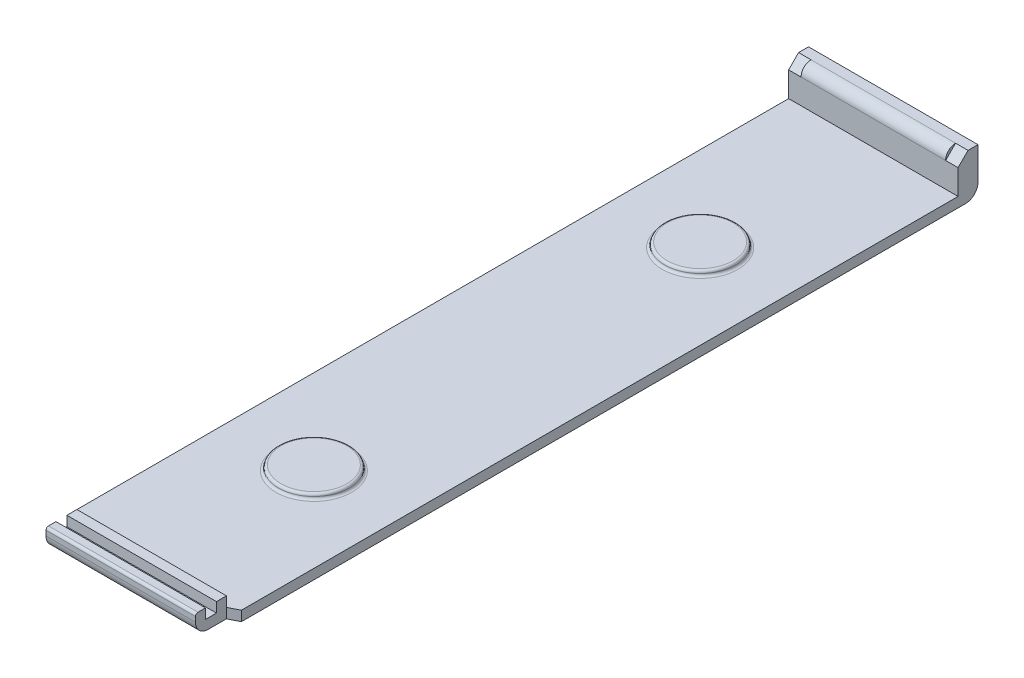
from build123d import *

# Parameters (mm, degrees)
SKETCH1_W                       = 39
SKETCH1_H                       = 155
BOSS_EXTRUDE1_DEPTH             = 2
BOSS_EXTRUDE2_DEPTH             = 38
SKETCH3_W                       = 2
SKETCH3_H                       = 2
BOSS_EXTRUDE3_DEPTH             = 38
SKETCH4_W                       = 2
SKETCH4_H                       = 2
BOSS_EXTRUDE4_DEPTH             = 151
SKETCH6_W                       = 35
SKETCH6_H                       = 2.2
CUT_EXTRUDE1_DEPTH              = 160.340045186
SKETCH7_W                       = 35
SKETCH7_H                       = 2.2
CUT_EXTRUDE2_DEPTH              = 89.490112442
SKETCH5_W                       = 31
SKETCH5_H                       = 2
BOSS_EXTRUDE5_DEPTH             = 2
BOSS_EXTRUDE6_REACH             = 91.367
SKETCH8_W                       = 2
SKETCH8_H                       = 2
BOSS_EXTRUDE6_DIRECTION_2_REACH = 91.367
SKETCH10_W                      = 2
SKETCH10_H                      = 2.2
SKETCH10_W_2                    = 2.2
SKETCH10_H_2                    = 2
BOSS_EXTRUDE8_DEPTH             = 2
SKETCH11_W                      = 2
SKETCH11_H                      = 2.2
SKETCH11_W_2                    = 2.2
SKETCH11_H_2                    = 2
BOSS_EXTRUDE9_DEPTH             = 2
FILLET2_R                       = 2.5
SKETCH14_W                      = 36.5
SKETCH14_H                      = 7.75
BOSS_EXTRUDE10_DEPTH            = 2
SKETCH13_W                      = 31
SKETCH13_H                      = 3
CUT_EXTRUDE4_DEPTH              = 2
FILLET3_R                       = 2
FILLET4_R                       = 0.5
SKETCH15_R                      = 5.1
CUT_EXTRUDE5_DEPTH              = 90.367219941
SKETCH16_R                      = 7.1
BOSS_EXTRUDE11_DEPTH            = 1
FILLET5_R                       = 0.5
CUT_EXTRUDE3_DEPTH              = 160.340045186
FILLET6_R                       = 0.4
FILLET7_R                       = 0.5
CUT_EXTRUDE8_DEPTH              = 90.367220028
CUT_EXTRUDE8_DEPTH_BACK         = 90.367220028
CUT_EXTRUDE11_DEPTH             = 81.420768473
CUT_EXTRUDE12_DEPTH             = 80.851424566
CUT_EXTRUDE13_DEPTH             = 2.5


with BuildPart() as part:
    # Sketch1 → Boss-Extrude1 (new body)
    with BuildSketch(Plane(origin=(0, 0, 0), x_dir=(1, 0, 0), z_dir=(0, 1, 0))):
        Rectangle(SKETCH1_W, SKETCH1_H)
    extrude(amount=BOSS_EXTRUDE1_DEPTH)

    # Sketch2 → Boss-Extrude2 (add)
    with BuildSketch(Plane(origin=(0, 2, 0), x_dir=(1, 0, 0), z_dir=(0, 1, 0))):
        Polygon((-17.5, -77.5), (-17.5, -75.5), (-17.5, 75.5), (17.5, 75.5), (17.5, -75.5), (17.5, -77.5), (19.5, -77.5), (19.5, 77.5), (-19.5, 77.5), (-19.5, -77.5), align=None)
    extrude(amount=BOSS_EXTRUDE2_DEPTH)

    # Sketch3 → Boss-Extrude3 (add)
    with BuildSketch(Plane(origin=(0, 2, 0), x_dir=(1, 0, 0), z_dir=(0, 1, 0))):
        with Locations((-16.5, -76.5)):
            Rectangle(SKETCH3_W, SKETCH3_H)
        with Locations((-16.5, -72.3)):
            Rectangle(SKETCH3_W, SKETCH3_H)
        with Locations((16.5, -76.5)):
            Rectangle(SKETCH3_W, SKETCH3_H)
        with Locations((16.5, -72.3)):
            Rectangle(SKETCH3_W, SKETCH3_H)
    extrude(amount=BOSS_EXTRUDE3_DEPTH)

    # Sketch4 → Boss-Extrude4 (add)
    with BuildSketch(Plane.XY.offset(-75.5)):
        with Locations((-16.5, 39)):
            Rectangle(SKETCH4_W, SKETCH4_H)
        Polygon((-15.5, 33.8), (-17.5, 31.8), (-17.5, 35.8), (-15.5, 35.8), align=None)
        Polygon((15.5, 35.8), (17.5, 35.8), (17.5, 31.8), (15.5, 33.8), align=None)
        with Locations((16.5, 39)):
            Rectangle(SKETCH4_W, SKETCH4_H)
    extrude(amount=BOSS_EXTRUDE4_DEPTH)

    # Sketch6 → Cut-Extrude1 (cut, through all)
    with BuildSketch(Plane.XY.offset(-75.5)):
        with Locations((0, 36.9)):
            Rectangle(SKETCH6_W, SKETCH6_H)
    extrude(amount=CUT_EXTRUDE1_DEPTH, mode=Mode.SUBTRACT)

    # Sketch7 → Cut-Extrude2 (cut, through all)
    with BuildSketch(Plane(origin=(0, 2, 0), x_dir=(1, 0, 0), z_dir=(0, 1, 0))):
        with Locations((0, -74.4)):
            Rectangle(SKETCH7_W, SKETCH7_H)
    extrude(amount=CUT_EXTRUDE2_DEPTH, mode=Mode.SUBTRACT)

    # Sketch5 → Boss-Extrude5 (add)
    with BuildSketch(Plane(origin=(0, 2, 0), x_dir=(1, 0, 0), z_dir=(0, 1, 0))):
        with Locations((0, -76.5)):
            Rectangle(SKETCH5_W, SKETCH5_H)
        with Locations((0, -72.3)):
            Rectangle(SKETCH5_W, SKETCH5_H)
    extrude(amount=BOSS_EXTRUDE5_DEPTH)

    # Boss-Extrude6: up to this face of the body (flat: up to its plane)
    boss_extrude6_end = Plane(part.part.faces().sort_by_distance((17.5, 16.9, -2.1))[0])
    # Sketch8 → Boss-Extrude6 (add, up to the picked face)
    with BuildSketch(Plane(origin=(0, 0, 0), x_dir=(0, 0, -1), z_dir=(1, 0, 0)), mode=Mode.PRIVATE) as boss_extrude6_sk1:
        with Locations((74.5, 39)):
            Rectangle(SKETCH8_W, SKETCH8_H)
    boss_extrude6_tool1 = split(extrude(boss_extrude6_sk1.sketch, amount=BOSS_EXTRUDE6_REACH, mode=Mode.PRIVATE), bisect_by=boss_extrude6_end, keep=Keep.BOTH, mode=Mode.PRIVATE)
    # Sketch8 → Boss-Extrude6 (add, up to the picked face)
    with BuildSketch(Plane(origin=(0, 0, 0), x_dir=(0, 0, -1), z_dir=(1, 0, 0)), mode=Mode.PRIVATE) as boss_extrude6_sk2:
        Polygon((75.5, 35.8), (73.5, 35.8), (73.5, 33.8), (75.5, 31.8), align=None)
    boss_extrude6_tool2 = split(extrude(boss_extrude6_sk2.sketch, amount=BOSS_EXTRUDE6_REACH, mode=Mode.PRIVATE), bisect_by=boss_extrude6_end, keep=Keep.BOTH, mode=Mode.PRIVATE)
    add(boss_extrude6_tool1.solids().sort_by(Axis((0, 39, -74.5), (1, 0, 0)))[0])
    add(boss_extrude6_tool2.solids().sort_by(Axis((0, 34.244444, -74.611111), (1, 0, 0)))[0])

    # Boss-Extrude6 direction 2: up to this face of the body (flat: up to its plane)
    boss_extrude6_direction_2_end = Plane(part.part.faces().sort_by_distance((-17.5, 16.9, -2.1))[0])
    # Sketch8 → Boss-Extrude6 direction 2 (add, up to the picked face)
    with BuildSketch(Plane(origin=(0, 0, 0), x_dir=(0, 0, -1), z_dir=(1, 0, 0)), mode=Mode.PRIVATE) as boss_extrude6_direction_2_sk1:
        with Locations((74.5, 39)):
            Rectangle(SKETCH8_W, SKETCH8_H)
    boss_extrude6_direction_2_tool1 = split(extrude(boss_extrude6_direction_2_sk1.sketch, amount=-BOSS_EXTRUDE6_DIRECTION_2_REACH, mode=Mode.PRIVATE), bisect_by=boss_extrude6_direction_2_end, keep=Keep.BOTH, mode=Mode.PRIVATE)
    # Sketch8 → Boss-Extrude6 direction 2 (add, up to the picked face)
    with BuildSketch(Plane(origin=(0, 0, 0), x_dir=(0, 0, -1), z_dir=(1, 0, 0)), mode=Mode.PRIVATE) as boss_extrude6_direction_2_sk2:
        Polygon((75.5, 35.8), (73.5, 35.8), (73.5, 33.8), (75.5, 31.8), align=None)
    boss_extrude6_direction_2_tool2 = split(extrude(boss_extrude6_direction_2_sk2.sketch, amount=-BOSS_EXTRUDE6_DIRECTION_2_REACH, mode=Mode.PRIVATE), bisect_by=boss_extrude6_direction_2_end, keep=Keep.BOTH, mode=Mode.PRIVATE)
    add(boss_extrude6_direction_2_tool1.solids().sort_by(Axis((0, 39, -74.5), (-1, 0, 0)))[0])
    add(boss_extrude6_direction_2_tool2.solids().sort_by(Axis((0, 34.244444, -74.611111), (-1, 0, 0)))[0])

    # Sketch10 → Boss-Extrude8 (add)
    with BuildSketch(Plane(origin=(-17.5, 0, 0), x_dir=(0, 0, -1), z_dir=(1, 0, 0))):
        with Locations((-76.5, 36.9)):
            Rectangle(SKETCH10_W, SKETCH10_H)
        with Locations((-74.4, 39)):
            Rectangle(SKETCH10_W_2, SKETCH10_H_2)
    extrude(amount=BOSS_EXTRUDE8_DEPTH)

    # Sketch11 → Boss-Extrude9 (add)
    with BuildSketch(Plane.ZY.offset(-17.5)):
        with Locations((76.5, 36.9)):
            Rectangle(SKETCH11_W, SKETCH11_H)
        with Locations((74.4, 39)):
            Rectangle(SKETCH11_W_2, SKETCH11_H_2)
    extrude(amount=BOSS_EXTRUDE9_DEPTH)

    # Fillet2
    fillet2_edges = [part.edges().sort_by_distance(p)[0] for p in [
        (-17.5, 16.9, 71.3),
        (17.5, 16.9, 71.3),
        (19.5, 20, 77.5),
        (-19.5, 20, 77.5),
        (-19.5, 20, -77.5),
        (-17.5, 16.9, -75.5),
        (17.5, 16.9, -75.5),
        (19.5, 20, -77.5),
        (19.5, 40, 0),
        (-19.5, 40, 0),
        (19.5, 0, 0),
        (-19.5, 0, 0),
        (0, 40, -77.5),
        (0, 0, 77.5),
        (0, 0, -77.5),
        (-17.5, 40, 77.5),
        (17.5, 40, 77.5),
    ]]
    fillet(fillet2_edges, radius=FILLET2_R)

    # Sketch14 → Boss-Extrude10 (add)
    with BuildSketch(Plane.XY.offset(-75.5)):
        with Locations((0, 5.125)):
            Rectangle(SKETCH14_W, SKETCH14_H)
    extrude(amount=BOSS_EXTRUDE10_DEPTH)

    # Sketch13 → Cut-Extrude4 (cut)
    with BuildSketch(Plane(origin=(0, 0, -77.5), x_dir=(-1, 0, 0), z_dir=(0, 0, -1))):
        with Locations((0, 5.5)):
            Rectangle(SKETCH13_W, SKETCH13_H)
    extrude(amount=-CUT_EXTRUDE4_DEPTH, mode=Mode.SUBTRACT)

    # Fillet3
    fillet3_edges = [part.edges().sort_by_distance(p)[0] for p in [
        (0, 9, -73.5),
    ]]
    fillet(fillet3_edges, radius=FILLET3_R - 0.0001)  # a hair under: the kernel refuses the full size

    # Fillet4
    fillet4_edges = [part.edges().sort_by_distance(p)[0] for p in [
        (15.5, 5.5, -75.5),
        (15.5, 4, -76.5),
        (0, 7, -75.5),
        (15.5, 7, -76.5),
        (-15.5, 5.5, -75.5),
        (-15.5, 7, -76.5),
        (0, 4, -75.5),
        (-15.5, 4, -76.5),
        (15.5, 5.5, -77.5),
        (0, 4, -77.5),
        (-15.5, 5.5, -77.5),
        (0, 7, -77.5),
    ]]
    fillet(fillet4_edges, radius=FILLET4_R)

    # Sketch15 → Cut-Extrude5 (cut, through all)
    with BuildSketch(Plane.XZ):
        with Locations(Location((0, 38.75, 0), (0, 0, 270))):
            Circle(SKETCH15_R)
        with Locations(Location((0, -38.75, 0), (0, 0, 270))):
            Circle(SKETCH15_R)
    extrude(amount=-CUT_EXTRUDE5_DEPTH, mode=Mode.SUBTRACT)

    # Sketch16 → Boss-Extrude11 (add)
    with BuildSketch(Plane(origin=(0, 2, 0), x_dir=(1, 0, 0), z_dir=(0, 1, 0))):
        with Locations(Location((0, 38.75, 0), (0, 0, 270))):
            Circle(SKETCH16_R)
        with Locations(Location((0, -38.75, 0), (0, 0, 270))):
            Circle(SKETCH16_R)
    extrude(amount=BOSS_EXTRUDE11_DEPTH)

    # Fillet5
    fillet5_edges = [part.edges().sort_by_distance(p)[0] for p in [
        (0, 2, -45.85),
        (0, 3, -45.85),
        (0, 2, 31.65),
        (0, 3, 31.65),
    ]]
    fillet(fillet5_edges, radius=FILLET5_R - 0.0001)  # a hair under: the kernel refuses the full size

    # Sketch12 → Cut-Extrude3 (cut, through all)
    with BuildSketch(Plane.XY.offset(-75.5)):
        with BuildLine():
            Line((1.668907005, 12.688040659), (2.22520934, 10.250720878))
            ThreePointArc((2.22520934, 10.250720878), (4.338837391, 10.990311321), (6.234898019, 12.181685175))
            Line((6.234898019, 12.181685175), (4.676173514, 14.136263881))
            ThreePointArc((4.676173514, 14.136263881), (3.254128043, 13.242733491), (1.668907005, 12.688040659))
        make_face()
        with BuildLine():
            ThreePointArc((-6.234898019, 12.181685175), (-4.338837391, 10.990311321), (-2.22520934, 10.250720878))
            Line((-2.22520934, 10.250720878), (-1.668907005, 12.688040659))
            ThreePointArc((-1.668907005, 12.688040659), (-3.254128043, 13.242733491), (-4.676173514, 14.136263881))
            Line((-4.676173514, 14.136263881), (-6.234898019, 12.181685175))
        make_face()
        with BuildLine():
            ThreePointArc((-10, 20), (-9.749279122, 17.77479066), (-9.009688679, 15.661162609))
            Line((-9.009688679, 15.661162609), (-6.757266509, 16.745871957))
            ThreePointArc((-6.757266509, 16.745871957), (-7.311959341, 18.331092995), (-7.5, 20))
            Line((-7.5, 20), (-10, 20))
        make_face()
        with BuildLine():
            ThreePointArc((-6.234898019, 27.818314825), (-7.818314825, 26.234898019), (-9.009688679, 24.338837391))
            Line((-9.009688679, 24.338837391), (-6.757266509, 23.254128043))
            ThreePointArc((-6.757266509, 23.254128043), (-5.863736119, 24.676173514), (-4.676173514, 25.863736119))
            Line((-4.676173514, 25.863736119), (-6.234898019, 27.818314825))
        make_face()
        with BuildLine():
            ThreePointArc((-1.668907005, 27.311959341), (-0.839733571, 27.452841574), (0, 27.5))
            Line((0, 27.5), (0, 30))
            ThreePointArc((0, 30), (-1.119644761, 29.937122099), (-2.22520934, 29.749279122))
            Line((-2.22520934, 29.749279122), (-1.668907005, 27.311959341))
        make_face()
        with BuildLine():
            Line((0, 30), (0, 27.5))
            ThreePointArc((0, 27.5), (0.839733571, 27.452841574), (1.668907005, 27.311959341))
            Line((1.668907005, 27.311959341), (2.22520934, 29.749279122))
            ThreePointArc((2.22520934, 29.749279122), (1.119644761, 29.937122099), (0, 30))
        make_face()
        with BuildLine():
            Line((6.757266509, 23.254128043), (9.009688679, 24.338837391))
            ThreePointArc((9.009688679, 24.338837391), (7.818314825, 26.234898019), (6.234898019, 27.818314825))
            Line((6.234898019, 27.818314825), (4.676173514, 25.863736119))
            ThreePointArc((4.676173514, 25.863736119), (5.863736119, 24.676173514), (6.757266509, 23.254128043))
        make_face()
        with BuildLine():
            Line((6.757266509, 16.745871957), (9.009688679, 15.661162609))
            ThreePointArc((9.009688679, 15.661162609), (9.749279122, 17.77479066), (10, 20))
            Line((10, 20), (7.5, 20))
            ThreePointArc((7.5, 20), (7.311959341, 18.331092995), (6.757266509, 16.745871957))
        make_face()
        with BuildLine():
            ThreePointArc((2.5, 20), (2.43731978, 19.443697665), (2.25242217, 18.915290652))
            Line((2.25242217, 18.915290652), (4.50484434, 17.830581304))
            ThreePointArc((4.50484434, 17.830581304), (4.874639561, 18.88739533), (5, 20))
            Line((5, 20), (2.5, 20))
        make_face()
        with BuildLine():
            ThreePointArc((1.558724505, 21.954578706), (1.954578706, 21.558724505), (2.25242217, 21.084709348))
            Line((2.25242217, 21.084709348), (4.50484434, 22.169418696))
            ThreePointArc((4.50484434, 22.169418696), (3.909157412, 23.117449009), (3.117449009, 23.909157412))
            Line((3.117449009, 23.909157412), (1.558724505, 21.954578706))
        make_face()
        with BuildLine():
            Line((0, 25), (0, 22.5))
            ThreePointArc((0, 22.5), (0.27991119, 22.484280525), (0.556302335, 22.43731978))
            Line((0.556302335, 22.43731978), (1.11260467, 24.874639561))
            ThreePointArc((1.11260467, 24.874639561), (0.559822381, 24.968561049), (0, 25))
        make_face()
        with BuildLine():
            ThreePointArc((-0.556302335, 22.43731978), (-0.27991119, 22.484280525), (0, 22.5))
            Line((0, 22.5), (0, 25))
            ThreePointArc((0, 25), (-0.559822381, 24.968561049), (-1.11260467, 24.874639561))
            Line((-1.11260467, 24.874639561), (-0.556302335, 22.43731978))
        make_face()
        with BuildLine():
            ThreePointArc((-2.25242217, 21.084709348), (-1.954578706, 21.558724505), (-1.558724505, 21.954578706))
            Line((-1.558724505, 21.954578706), (-3.117449009, 23.909157412))
            ThreePointArc((-3.117449009, 23.909157412), (-3.909157412, 23.117449009), (-4.50484434, 22.169418696))
            Line((-4.50484434, 22.169418696), (-2.25242217, 21.084709348))
        make_face()
        with BuildLine():
            ThreePointArc((-2.25242217, 18.915290652), (-2.43731978, 19.443697665), (-2.5, 20))
            Line((-2.5, 20), (-5, 20))
            ThreePointArc((-5, 20), (-4.874639561, 18.88739533), (-4.50484434, 17.830581304))
            Line((-4.50484434, 17.830581304), (-2.25242217, 18.915290652))
        make_face()
        with BuildLine():
            ThreePointArc((-3.117449009, 16.090842588), (-2.169418696, 15.49515566), (-1.11260467, 15.125360439))
            Line((-1.11260467, 15.125360439), (-0.556302335, 17.56268022))
            ThreePointArc((-0.556302335, 17.56268022), (-1.084709348, 17.74757783), (-1.558724505, 18.045421294))
            Line((-1.558724505, 18.045421294), (-3.117449009, 16.090842588))
        make_face()
        with BuildLine():
            Line((0.556302335, 17.56268022), (1.11260467, 15.125360439))
            ThreePointArc((1.11260467, 15.125360439), (2.169418696, 15.49515566), (3.117449009, 16.090842588))
            Line((3.117449009, 16.090842588), (1.558724505, 18.045421294))
            ThreePointArc((1.558724505, 18.045421294), (1.084709348, 17.74757783), (0.556302335, 17.56268022))
        make_face()
    extrude(amount=-CUT_EXTRUDE3_DEPTH, mode=Mode.SUBTRACT)

    # Fillet6
    fillet6_edges = [part.edges().sort_by_distance(p)[0] for p in [
        (5.863736119, 24.676173514, -75.5),
        (5.455535766, 26.841025472, -75.5),
        (7.818314825, 26.234898019, -77.5),
        (7.883477594, 23.796482717, -77.5),
        (5.863736119, 24.676173514, -77.5),
        (5.455535766, 26.841025472, -77.5),
        (7.883477594, 23.796482717, -75.5),
        (7.818314825, 26.234898019, -75.5),
        (7.311959341, 18.331092995, -75.5),
        (8.75, 20, -75.5),
        (9.749279122, 17.77479066, -77.5),
        (7.883477594, 16.203517283, -77.5),
        (7.311959341, 18.331092995, -77.5),
        (8.75, 20, -77.5),
        (7.883477594, 16.203517283, -75.5),
        (9.749279122, 17.77479066, -75.5),
        (2.43731978, 19.443697665, -75.5),
        (3.75, 20, -75.5),
        (4.874639561, 18.88739533, -77.5),
        (3.378633255, 18.372935978, -77.5),
        (2.43731978, 19.443697665, -77.5),
        (3.75, 20, -77.5),
        (3.378633255, 18.372935978, -75.5),
        (4.874639561, 18.88739533, -75.5),
        (1.954578706, 21.558724505, -75.5),
        (2.338086757, 22.931868059, -75.5),
        (3.909157412, 23.117449009, -77.5),
        (3.378633255, 21.627064022, -77.5),
        (1.954578706, 21.558724505, -77.5),
        (2.338086757, 22.931868059, -77.5),
        (3.378633255, 21.627064022, -75.5),
        (3.909157412, 23.117449009, -75.5),
        (0, 27.5, -75.5),
        (-1.947058172, 28.530619232, -75.5),
        (0, 30, -77.5),
        (1.947058172, 28.530619232, -77.5),
        (0, 27.5, -77.5),
        (-1.947058172, 28.530619232, -77.5),
        (1.947058172, 28.530619232, -75.5),
        (0, 30, -75.5),
        (-5.863736119, 24.676173514, -75.5),
        (-7.883477594, 23.796482717, -75.5),
        (-7.818314825, 26.234898019, -77.5),
        (-5.455535766, 26.841025472, -77.5),
        (-5.863736119, 24.676173514, -77.5),
        (-7.883477594, 23.796482717, -77.5),
        (-5.455535766, 26.841025472, -75.5),
        (-7.818314825, 26.234898019, -75.5),
        (-7.311959341, 18.331092995, -75.5),
        (-7.883477594, 16.203517283, -75.5),
        (-9.749279122, 17.77479066, -77.5),
        (-8.75, 20, -77.5),
        (-7.311959341, 18.331092995, -77.5),
        (-7.883477594, 16.203517283, -77.5),
        (-8.75, 20, -75.5),
        (-9.749279122, 17.77479066, -75.5),
        (-3.254128043, 13.242733491, -75.5),
        (-1.947058172, 11.469380768, -75.5),
        (-4.338837391, 10.990311321, -77.5),
        (-5.455535766, 13.158974528, -77.5),
        (-3.254128043, 13.242733491, -77.5),
        (-1.947058172, 11.469380768, -77.5),
        (-5.455535766, 13.158974528, -75.5),
        (-4.338837391, 10.990311321, -75.5),
        (1.084709348, 17.74757783, -75.5),
        (2.338086757, 17.068131941, -75.5),
        (2.169418696, 15.49515566, -77.5),
        (0.834453502, 16.344020329, -77.5),
        (1.084709348, 17.74757783, -77.5),
        (2.338086757, 17.068131941, -77.5),
        (0.834453502, 16.344020329, -75.5),
        (2.169418696, 15.49515566, -75.5),
        (-2.43731978, 19.443697665, -75.5),
        (-3.378633255, 18.372935978, -75.5),
        (-4.874639561, 18.88739533, -77.5),
        (-3.75, 20, -77.5),
        (-2.43731978, 19.443697665, -77.5),
        (-3.378633255, 18.372935978, -77.5),
        (-3.75, 20, -75.5),
        (-4.874639561, 18.88739533, -75.5),
        (-1.084709348, 17.74757783, -75.5),
        (-0.834453502, 16.344020329, -75.5),
        (-2.169418696, 15.49515566, -77.5),
        (-2.338086757, 17.068131941, -77.5),
        (-1.084709348, 17.74757783, -77.5),
        (-0.834453502, 16.344020329, -77.5),
        (-2.338086757, 17.068131941, -75.5),
        (-2.169418696, 15.49515566, -75.5),
        (-1.954578706, 21.558724505, -75.5),
        (-3.378633255, 21.627064022, -75.5),
        (-3.909157412, 23.117449009, -77.5),
        (-2.338086757, 22.931868059, -77.5),
        (-1.954578706, 21.558724505, -77.5),
        (-3.378633255, 21.627064022, -77.5),
        (-2.338086757, 22.931868059, -75.5),
        (-3.909157412, 23.117449009, -75.5),
        (0, 25, -77.5),
        (0.834453502, 23.655979671, -77.5),
        (0, 22.5, -75.5),
        (-0.834453502, 23.655979671, -75.5),
        (0, 22.5, -77.5),
        (-0.834453502, 23.655979671, -77.5),
        (0, 25, -75.5),
        (0.834453502, 23.655979671, -75.5),
        (3.254128043, 13.242733491, -75.5),
        (5.455535766, 13.158974528, -75.5),
        (4.338837391, 10.990311321, -77.5),
        (1.947058172, 11.469380768, -77.5),
        (3.254128043, 13.242733491, -77.5),
        (5.455535766, 13.158974528, -77.5),
        (1.947058172, 11.469380768, -75.5),
        (4.338837391, 10.990311321, -75.5),
    ]]
    fillet(fillet6_edges, radius=FILLET6_R)

    # Fillet7
    fillet7_edges = [part.edges().sort_by_distance(p)[0] for p in [
        (15.5, 40, 0.75),
        (0, 4, 77.5),
        (0, 40, -73.5),
        (-15.5, 40, 0.75),
        (-15.5, 20.75, 77.5),
        (-15.5, 39.267766953, 76.767766953),
        (15.5, 20.75, 77.5),
        (15.5, 39.267766953, 76.767766953),
    ]]
    fillet(fillet7_edges, radius=FILLET7_R)

    # Sketch20 → Cut-Extrude8 (cut, two sides: drawn at the far end of the back side and taken through both)
    with BuildSketch(Plane(origin=(0, 0, 0), x_dir=(0, 0, -1), z_dir=(1, 0, 0)).offset(-CUT_EXTRUDE8_DEPTH_BACK)):
        Polygon((77.5, 40), (77.5, 9), (75.5, 9), (73.5, 9), (73.5, 4), (-75.5, 4), (-77.5, 4), (-77.5, 40), align=None)
    extrude(amount=CUT_EXTRUDE8_DEPTH + CUT_EXTRUDE8_DEPTH_BACK, mode=Mode.SUBTRACT)

    # Sketch21 → Cut-Extrude11 (cut, through all)
    with BuildSketch(Plane(origin=(0, 0, 0), x_dir=(1, 0, 0), z_dir=(0, 1, 0))):
        Polygon((17, 77.5), (17, 73.5), (17, -77.5), (19.5, -77.5), (19.5, 77.5), align=None)
        Polygon((-17, 77.5), (-17, 73.5), (-17, -77.5), (-19.5, -77.5), (-19.5, 77.5), align=None)
    extrude(amount=CUT_EXTRUDE11_DEPTH, mode=Mode.SUBTRACT)

    # Sketch24 → Cut-Extrude12 (cut, through all)
    with BuildSketch(Plane(origin=(0, 0, 0), x_dir=(1, 0, 0), z_dir=(0, 1, 0))):
        Polygon((17, -77.5), (15, -77.5), (15, -71.3), (17, -70.3), align=None)
        Polygon((-17, -70.3), (-17, -77.5), (-15, -77.5), (-15, -71.3), align=None)
    extrude(amount=CUT_EXTRUDE12_DEPTH, mode=Mode.SUBTRACT)

    # Sketch26 → Cut-Extrude13 (cut)
    with BuildSketch(Plane(origin=(17, 0, 0), x_dir=(0, 0, -1), z_dir=(1, 0, 0))):
        Polygon((75.5, 9), (73.5, 7), (73.5, 9), align=None)
    cut_extrude13 = extrude(amount=-CUT_EXTRUDE13_DEPTH, mode=Mode.SUBTRACT)

    # Mirror1: Cut-Extrude13 across plane
    add(cut_extrude13.mirror(Plane(origin=(0, 0, 0), x_dir=(0, 0, 1), z_dir=(1, 0, 0))), mode=Mode.SUBTRACT)


solid = part.part
